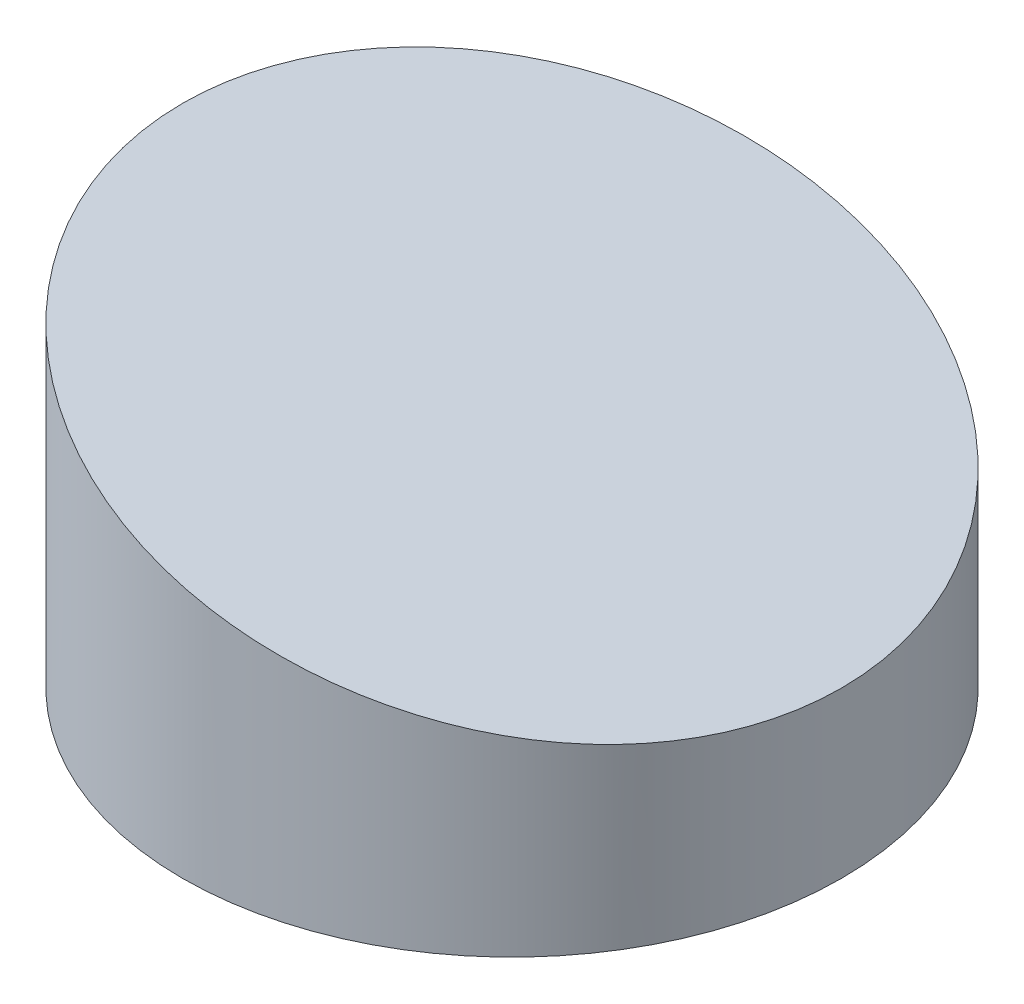
from build123d import *

# Parameters (mm, degrees)
SKETCH1_R               = 12.7
BOSS_EXTRUDE1_DEPTH     = 13.16
CUT_EXTRUDE4_DEPTH      = 23.265794394
CUT_EXTRUDE4_DEPTH_BACK = 23.265794394
SKETCH4_R               = 1.595
CUT_EXTRUDE9_DEPTH      = 4.32


with BuildPart() as part:
    # Sketch1 → Boss-Extrude1 (new body)
    with BuildSketch(Plane(origin=(0, 0, 0), x_dir=(1, 0, 0), z_dir=(0, 1, 0))):
        Circle(SKETCH1_R)
    extrude(amount=BOSS_EXTRUDE1_DEPTH)

    # Sketch2 → Cut-Extrude4 (cut, two sides: drawn at the far end of the back side and taken through both)
    with BuildSketch(Plane.XY.offset(-CUT_EXTRUDE4_DEPTH_BACK)):
        Polygon((-77.620622605, 30.565883462), (-12.7, 13.16), (12.7, 6.35), (77.620622605, -11.055883462), (112.43238953, 118.785361749), (-42.808855681, 160.407128673), align=None)
    extrude(amount=CUT_EXTRUDE4_DEPTH + CUT_EXTRUDE4_DEPTH_BACK, mode=Mode.SUBTRACT)

    # Sketch4 → Cut-Extrude9 (cut)
    with BuildSketch(Plane(origin=(0, 0, 0), x_dir=(1, 0, 0), z_dir=(0, 1, 0))):
        with Locations((-9.525, 0)):
            Circle(SKETCH4_R)
        with Locations((0.005, 0)):
            Circle(SKETCH4_R)
        with Locations((9.535, 0)):
            Circle(SKETCH4_R)
        with Locations((4.7625, 8.248891971)):
            Circle(SKETCH4_R)
        with Locations((4.7625, -8.248891971)):
            Circle(SKETCH4_R)
    extrude(amount=CUT_EXTRUDE9_DEPTH, mode=Mode.SUBTRACT)


solid = part.part
